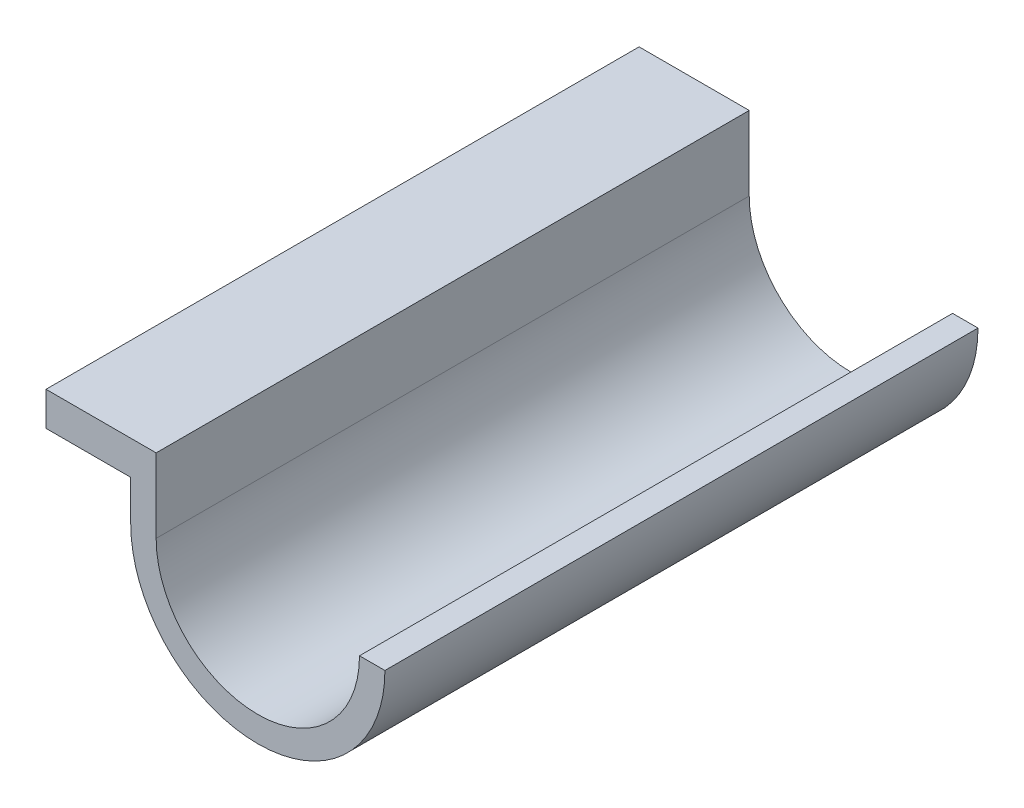
from build123d import *

# Parameters (mm, degrees)
SKETCH2_R           = 15
BOSS_EXTRUDE1_DEPTH = 70
SKETCH3_R           = 12
CUT_EXTRUDE1_DEPTH  = 74.143694192
SKETCH4_W           = 32.230614228
SKETCH4_H           = 15.278665706
CUT_EXTRUDE2_DEPTH  = 74.143694192
SKETCH5_W           = 3
SKETCH5_H           = 8.740769075
BOSS_EXTRUDE3_DEPTH = 70
SKETCH6_W           = 70
SKETCH6_H           = 4
BOSS_EXTRUDE4_DEPTH = 10


with BuildPart() as part:
    # Sketch2 → Boss-Extrude1 (new body)
    with BuildSketch(Plane.XY):
        Circle(SKETCH2_R)
    extrude(amount=BOSS_EXTRUDE1_DEPTH)

    # Sketch3 → Cut-Extrude1 (cut, through all)
    with BuildSketch(Plane.XY.offset(70)):
        Circle(SKETCH3_R)
    extrude(amount=-CUT_EXTRUDE1_DEPTH, mode=Mode.SUBTRACT)

    # Sketch4 → Cut-Extrude2 (cut, through all)
    with BuildSketch(Plane.XY.offset(70)):
        with Locations((0.085938844, 7.639332853)):
            Rectangle(SKETCH4_W, SKETCH4_H)
    extrude(amount=-CUT_EXTRUDE2_DEPTH, mode=Mode.SUBTRACT)

    # Sketch5 → Boss-Extrude3 (add)
    with BuildSketch(Plane.XY.offset(70)):
        with Locations((-13.5, 4.370384538)):
            Rectangle(SKETCH5_W, SKETCH5_H)
    extrude(amount=-BOSS_EXTRUDE3_DEPTH)

    # Sketch6 → Boss-Extrude4 (add)
    with BuildSketch(Plane.ZY.offset(15)):
        with Locations((35, 6.740769075)):
            Rectangle(SKETCH6_W, SKETCH6_H)
    extrude(amount=BOSS_EXTRUDE4_DEPTH)


solid = part.part
